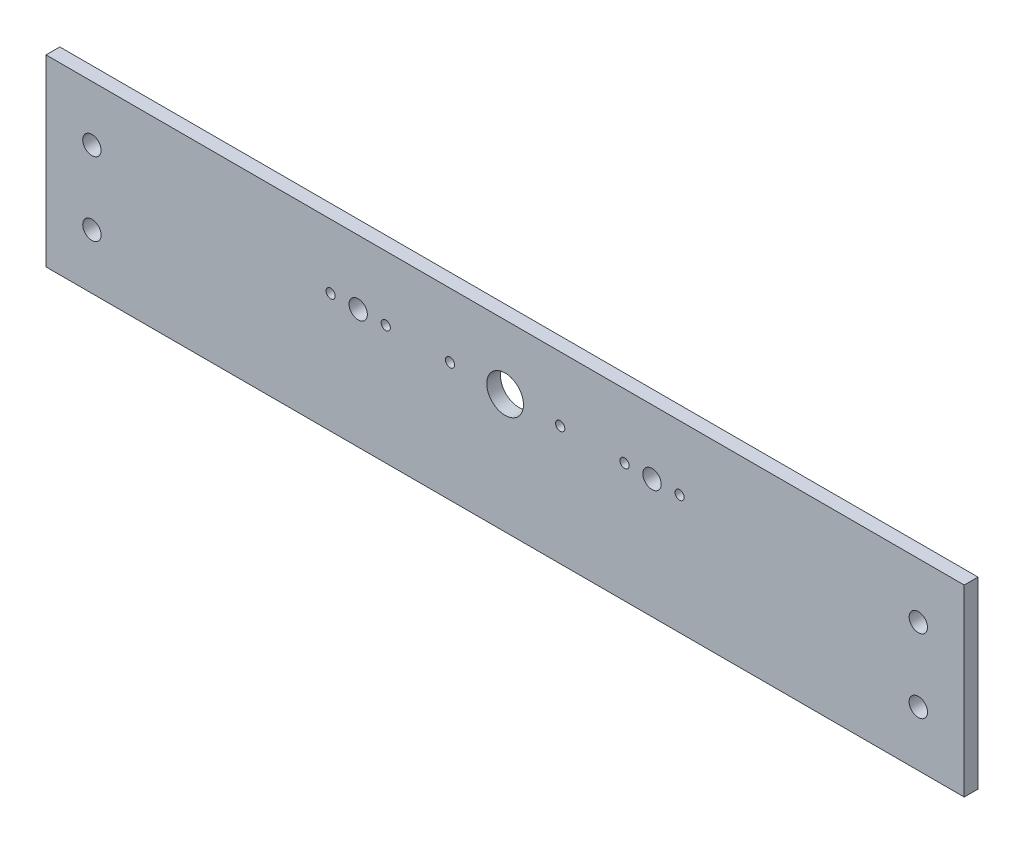
from build123d import *

# Parameters (mm, degrees)
SKETCH2_W           = 500
SKETCH2_H           = 100
BOSS_EXTRUDE1_DEPTH = 7.5
SKETCH9_R           = 5
SKETCH9_R_2         = 2.5
SKETCH9_R_3         = 10
CUT_EXTRUDE3_DEPTH  = 510.957106039
SKETCH11_R          = 5
CUT_EXTRUDE4_DEPTH  = 510.957106039


with BuildPart() as part:
    # Sketch2 → Boss-Extrude1 (new body)
    with BuildSketch(Plane.XY):
        with Locations((250, 50)):
            Rectangle(SKETCH2_W, SKETCH2_H)
    extrude(amount=BOSS_EXTRUDE1_DEPTH)

    # Sketch9 → Cut-Extrude3 (cut, through all)
    with BuildSketch(Plane.XY.offset(7.5)):
        with Locations((170, 65)):
            Circle(SKETCH9_R)
        with Locations((185, 65)):
            Circle(SKETCH9_R_2)
        with Locations((155, 65)):
            Circle(SKETCH9_R_2)
        with Locations((330, 65)):
            Circle(SKETCH9_R)
        with Locations((345, 65)):
            Circle(SKETCH9_R_2)
        with Locations((315, 65)):
            Circle(SKETCH9_R_2)
        with Locations((250, 65)):
            Circle(SKETCH9_R_3)
        with Locations((280, 65)):
            Circle(SKETCH9_R_2)
        with Locations((220, 65)):
            Circle(SKETCH9_R_2)
    extrude(amount=-CUT_EXTRUDE3_DEPTH, mode=Mode.SUBTRACT)

    # Sketch11 → Cut-Extrude4 (cut, through all)
    with BuildSketch(Plane.XY.offset(7.5)):
        with Locations((25, 70)):
            Circle(SKETCH11_R)
        with Locations((25, 30)):
            Circle(SKETCH11_R)
        with Locations((475, 30)):
            Circle(SKETCH11_R)
        with Locations((475, 70)):
            Circle(SKETCH11_R)
    extrude(amount=-CUT_EXTRUDE4_DEPTH, mode=Mode.SUBTRACT)


solid = part.part
